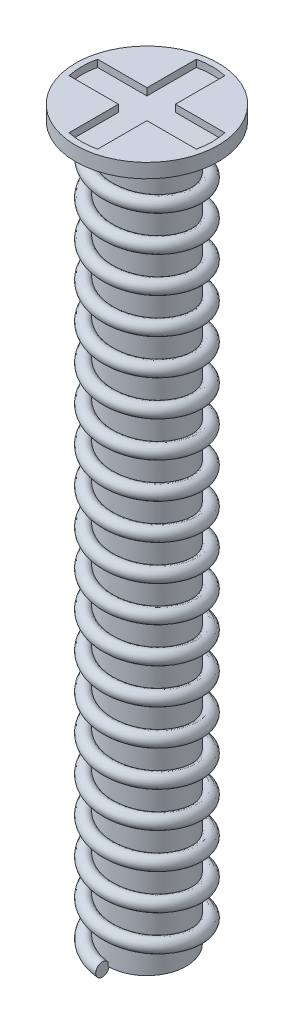
from build123d import *

# Parameters (mm, degrees)
CROQUIS1_R              = 0.55
SALIENTE_EXTRUIR1_DEPTH = 10
CROQUIS2_R              = 1
SALIENTE_EXTRUIR2_DEPTH = 0.2
BARRER1_PITCH           = 0.5
CORTAR_EXTRUIR1_DEPTH   = 0.1


with BuildPart() as part:
    # Croquis1 → Saliente-Extruir1 (new body)
    with BuildSketch(Plane(origin=(0, 0, 0), x_dir=(1, 0, 0), z_dir=(0, 1, 0))):
        with Locations(Location((0, 0, 0), (0, 0, 270))):
            Circle(CROQUIS1_R)
    extrude(amount=SALIENTE_EXTRUIR1_DEPTH)

    # Croquis2 → Saliente-Extruir2 (add)
    with BuildSketch(Plane(origin=(0, 10, 0), x_dir=(1, 0, 0), z_dir=(0, 1, 0))):
        with Locations(Location((0, 0, 0), (0, 0, 270))):
            Circle(CROQUIS2_R)
    extrude(amount=SALIENTE_EXTRUIR2_DEPTH)

    # Barrer1: arcs per turn and ends read off the stored shape
    # Barrer1: the profile of Croquis5 screwed along a left-hand helix through 20 turns, 6 arcs to a turn; built about Z, then put on its axis
    barrer1_z = Axis((0, 0, 0), (0, 0, 1))
    barrer1_corners = [(0.531230906, 0, 0), (0.625, 0, -0.093769094), (0.718769094, 0, 0), (0.625, 0, 0.093769094)]
    with BuildLine(mode=Mode.PRIVATE) as barrer1_profile:
        ThreePointArc((0.531230906, 0, 0), (0.558695237, 0, -0.066304763), (0.625, 0, -0.093769094))
        ThreePointArc((0.625, 0, -0.093769094), (0.691304763, 0, -0.066304763), (0.718769094, 0, 0))
        ThreePointArc((0.718769094, 0, 0), (0.691304763, 0, 0.066304763), (0.625, 0, 0.093769094))
        ThreePointArc((0.625, 0, 0.093769094), (0.558695237, 0, 0.066304763), (0.531230906, 0, 0))
    barrer1_cap = Face(barrer1_profile.wire())
    barrer1_arcs = [((0.531230906, 0, 0), (0.531230906, 0, -0.093769094), (0.625, 0, -0.093769094), (1, 0.7071067811865476, 1)), ((0.625, 0, -0.093769094), (0.718769094, 0, -0.093769094), (0.718769094, 0, 0), (1, 0.7071067811865476, 1)), ((0.718769094, 0, 0), (0.718769094, 0, 0.093769094), (0.625, 0, 0.093769094), (1, 0.7071067811865476, 1)), ((0.625, 0, 0.093769094), (0.531230906, 0, 0.093769094), (0.531230906, 0, 0), (1, 0.7071067811865476, 1))]  # start, shoulder, end, weights
    barrer1_turn_angles = [0, -30, -60, -90, -120, -150, -180, -210, -240, -270, -300, -330, -360]
    barrer1_turn_weights = [1, 0.8660254037844387, 1, 0.8660254037844387, 1, 0.8660254037844387, 1, 0.8660254037844387, 1, 0.8660254037844387, 1, 0.8660254037844387, 1]
    barrer1_turn_sides = [Face.make_bezier_surface([[Vector(p[j][0], p[j][1], 0).rotate(barrer1_z, barrer1_turn_angles[2 * i + k]) / barrer1_turn_weights[2 * i + k] + Vector(0, 0, p[j][2] + -BARRER1_PITCH * barrer1_turn_angles[2 * i + k] / 360) for k in range(3)] for j in range(3)], [[p[3][j] * barrer1_turn_weights[2 * i + k] for k in range(3)] for j in range(3)]) for p in barrer1_arcs for i in range(6)]
    barrer1 = Plane(origin=(0, 10, 0), x_dir=(0, 0, 1), z_dir=(0, -1, 0)) * Solid(Shell([*[p.moved(Location((0, 0, BARRER1_PITCH * i))) for i in range(20) for p in barrer1_turn_sides], barrer1_cap, barrer1_cap.rotate(barrer1_z, -7200).moved(Location((0, 0, -BARRER1_PITCH * -7200 / 360)))]))
    add(barrer1)

    # Croquis6 → Cortar-Extruir1 (cut)
    with BuildSketch(Plane(origin=(0, 10.2, 0), x_dir=(1, 0, 0), z_dir=(0, 1, 0))):
        with BuildLine():
            Line((0.2, 0.892803745), (0.2, 0.2))
            Line((0.2, 0.2), (0.892803745, 0.2))
            ThreePointArc((0.892803745, 0.2), (0.914930886, 0), (0.892803745, -0.2))
            Line((0.892803745, -0.2), (0.2, -0.2))
            Line((0.2, -0.2), (0.2, -0.892803745))
            ThreePointArc((0.2, -0.892803745), (0, -0.914930886), (-0.2, -0.892803745))
            Line((-0.2, -0.892803745), (-0.2, -0.2))
            Line((-0.2, -0.2), (-0.892803745, -0.2))
            ThreePointArc((-0.892803745, -0.2), (-0.914930886, 0), (-0.892803745, 0.2))
            Line((-0.892803745, 0.2), (-0.2, 0.2))
            Line((-0.2, 0.2), (-0.2, 0.892803745))
            ThreePointArc((-0.2, 0.892803745), (0, 0.914930886), (0.2, 0.892803745))
        make_face()
    extrude(amount=-CORTAR_EXTRUIR1_DEPTH, mode=Mode.SUBTRACT)


solid = part.part
